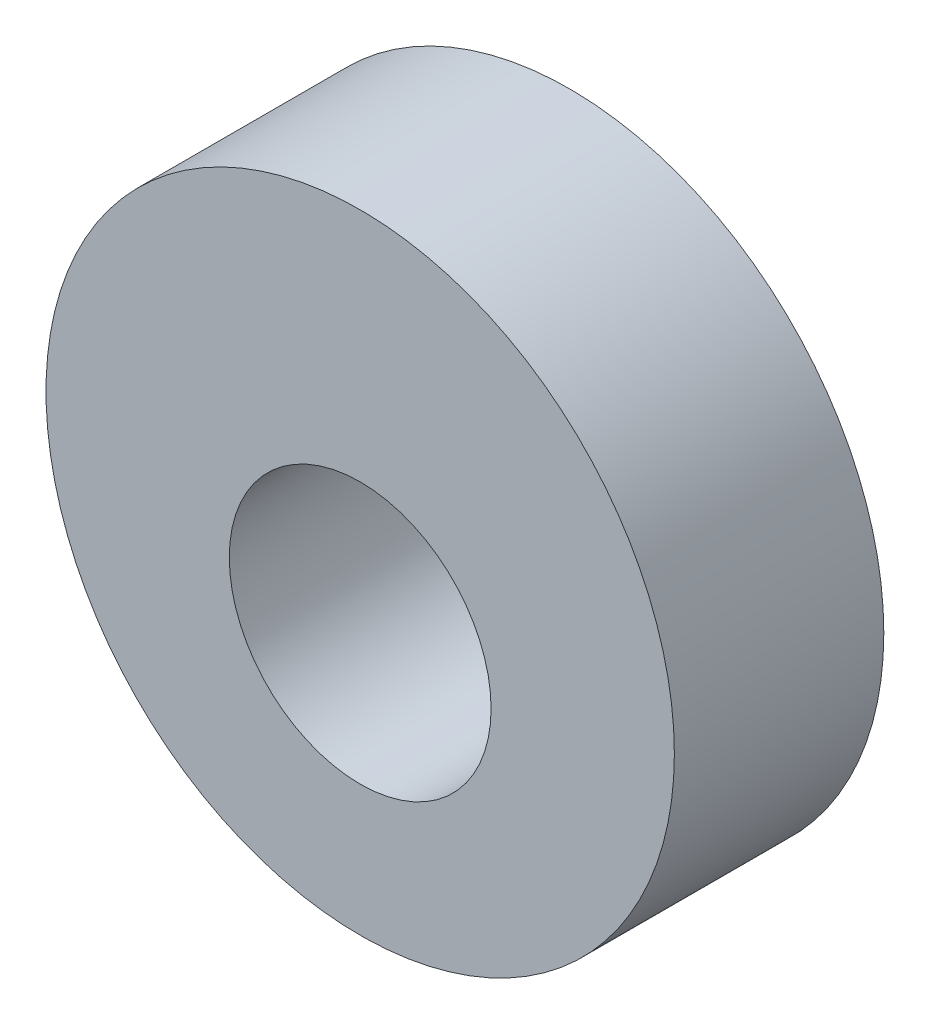
from build123d import *

# Parameters (mm, degrees)
SKETCH1_R                      = 9.525
EXTRUDE1_DEPTH                 = 3.175
F_5_16_0_3125_DIAMETER_HOLE1_D = 7.9375


with BuildPart() as part:
    # Sketch1 → Extrude1 (new, symmetric)
    with BuildSketch(Plane.XY):
        Circle(SKETCH1_R)
    extrude(amount=EXTRUDE1_DEPTH, both=True)

    # 5/16 (0.3125) Diameter Hole1 (through all)
    with Locations(Plane.XY.offset(3.175)):
        with Locations((0, -1.5875)):
            Hole(F_5_16_0_3125_DIAMETER_HOLE1_D / 2)


solid = part.part
